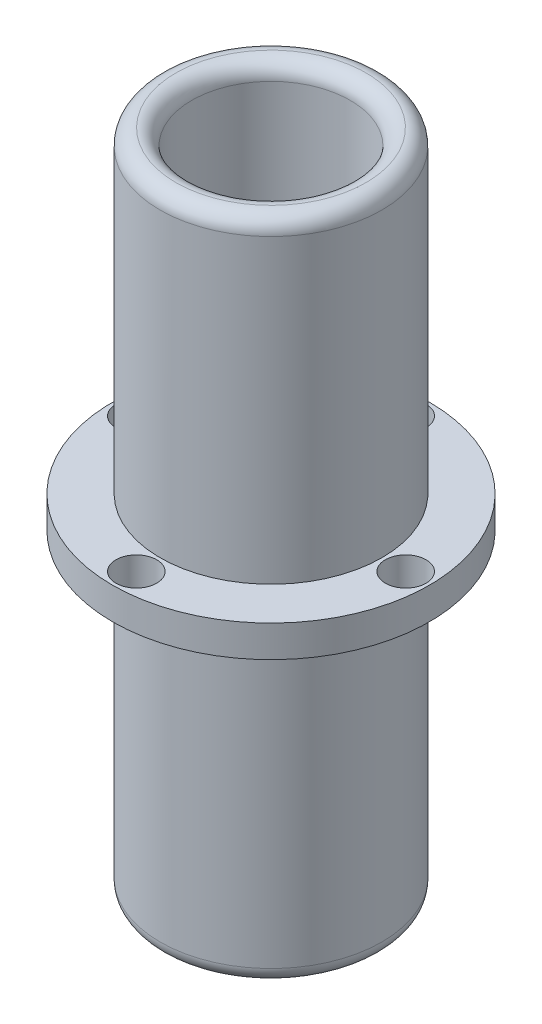
from build123d import *

# Parameters (mm, degrees)
SKETCH1_R                 = 8.89
SKETCH1_R_2               = 6.35
EXTRUDE_THIN1_DEPTH       = 25.4
SKETCH2_R                 = 12.7
SKETCH2_R_2               = 6.35
BOSS_EXTRUDE1_DEPTH       = 2.54
SKETCH3_R                 = 8.89
SKETCH3_R_2               = 6.35
EXTRUDE_THIN2_DEPTH       = 25.4
SKETCH4_R                 = 4.1275
CUT_EXTRUDE1_DEPTH        = 25.4
F_4_CLEARANCE_HOLE1_D     = 3.2639
F_4_CLEARANCE_HOLE1_DEPTH = 25.4
F_4_CLEARANCE_HOLE1_TIP   = 0.980574487
FILLET2_R                 = 1.27
FILLET3_R                 = 1.27


with BuildPart() as part:
    # Sketch1 → Extrude-Thin1 (new body)
    with BuildSketch(Plane(origin=(0, 0, 0), x_dir=(1, 0, 0), z_dir=(0, 1, 0))):
        Circle(SKETCH1_R)
        Circle(SKETCH1_R_2, mode=Mode.SUBTRACT)
    extrude(amount=EXTRUDE_THIN1_DEPTH)

    # Sketch2 → Boss-Extrude1 (add)
    with BuildSketch(Plane(origin=(0, 25.4, 0), x_dir=(1, 0, 0), z_dir=(0, 1, 0))):
        with Locations(Location((0, 0, 0), (0, 0, 270))):
            Circle(SKETCH2_R)
        with Locations(Location((0, 0, 0), (0, 0, 270))):
            Circle(SKETCH2_R_2, mode=Mode.SUBTRACT)
    extrude(amount=BOSS_EXTRUDE1_DEPTH)

    # Sketch3 → Extrude-Thin2 (add)
    with BuildSketch(Plane(origin=(0, 27.94, 0), x_dir=(1, 0, 0), z_dir=(0, 1, 0))):
        Circle(SKETCH3_R)
        Circle(SKETCH3_R_2, mode=Mode.SUBTRACT)
    extrude(amount=EXTRUDE_THIN2_DEPTH)

    # Sketch4 → Cut-Extrude1 (cut)
    with BuildSketch(Plane.XY):
        with Locations(Location((0, 39.37, 0), (0, 0, 90))):
            Circle(SKETCH4_R)
    extrude(amount=-CUT_EXTRUDE1_DEPTH, mode=Mode.SUBTRACT)

    # #4 Clearance Hole1
    with Locations(Plane(origin=(0, 27.94, 0), x_dir=(-1, 0, 0), z_dir=(0, 1, 0))):
        with Locations((-10.795, 0), (0, -10.795), (0, 10.795), (10.795, 0)):
            Hole(F_4_CLEARANCE_HOLE1_D / 2, depth=F_4_CLEARANCE_HOLE1_DEPTH)
            with Locations((0, 0, -(F_4_CLEARANCE_HOLE1_DEPTH + F_4_CLEARANCE_HOLE1_TIP / 2))):  # 118° drill point
                Cone(0, F_4_CLEARANCE_HOLE1_D / 2, F_4_CLEARANCE_HOLE1_TIP, mode=Mode.SUBTRACT)

    # Fillet2
    # the kernel refuses this fillet: 1.27 mm, written as the material it takes off along each edge
    with BuildSketch(Plane(origin=(0, 0, 0), x_dir=(1, 0, 0), z_dir=(0, 0, 1))) as fillet2_piece_1:
        with BuildLine():
            CenterArc((8.89 - FILLET2_R, FILLET2_R), FILLET2_R, 270, 90)
            Line((8.89 - FILLET2_R, 0), (8.89, 0))
            Line((8.89, 0), (8.89, FILLET2_R))
        make_face()
    revolve(axis=Axis((0, 0, 0), (0, 1, 0)), mode=Mode.SUBTRACT)
    with BuildSketch(Plane(origin=(0, 0, 0), x_dir=(1, 0, 0), z_dir=(0, 0, 1))) as fillet2_piece_2:
        with BuildLine():
            CenterArc((6.35 + FILLET2_R, FILLET2_R), FILLET2_R, 180, 90)
            Line((6.35, FILLET2_R), (6.35, 0))
            Line((6.35, 0), (6.35 + FILLET2_R, 0))
        make_face()
    revolve(axis=Axis((0, 0, 0), (0, 1, 0)), mode=Mode.SUBTRACT)

    # Fillet3
    # the kernel refuses this fillet: 1.27 mm, written as the material it takes off along each edge
    with BuildSketch(Plane(origin=(0, 53.34, 0), x_dir=(1, 0, 0), z_dir=(0, 0, 1))) as fillet3_piece_1:
        with BuildLine():
            CenterArc((8.89 - FILLET3_R, -FILLET3_R), FILLET3_R, 0, 90)
            Line((8.89 - FILLET3_R, 0), (8.89, 0))
            Line((8.89, 0), (8.89, -FILLET3_R))
        make_face()
    revolve(axis=Axis((0, 53.34, 0), (0, 1, 0)), mode=Mode.SUBTRACT)
    with BuildSketch(Plane(origin=(0, 53.34, 0), x_dir=(1, 0, 0), z_dir=(0, 0, 1))) as fillet3_piece_2:
        with BuildLine():
            CenterArc((6.35 + FILLET3_R, -FILLET3_R), FILLET3_R, 90, 90)
            Line((6.35 + FILLET3_R, 0), (6.35, 0))
            Line((6.35, 0), (6.35, -FILLET3_R))
        make_face()
    revolve(axis=Axis((0, 53.34, 0), (0, 1, 0)), mode=Mode.SUBTRACT)


solid = part.part
